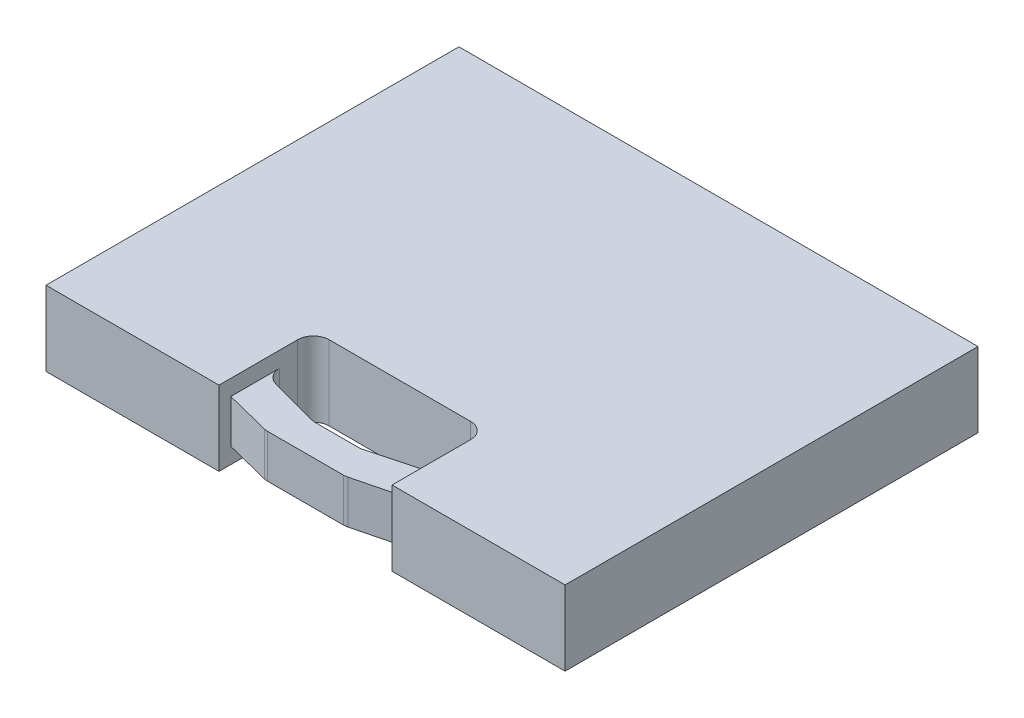
from build123d import *

# Parameters (mm, degrees)
SKETCH1_W           = 419.1
SKETCH1_H           = 333.375
BOSS_EXTRUDE1_DEPTH = 60.325
SKETCH2_W           = 139.7
SKETCH2_H           = 50.8
CUT_EXTRUDE1_DEPTH  = 275.47227689
CHAMFER1_SIZE       = 50.8
CHAMFER1_SIZE2      = 13.611818976
FILLET1_R           = 12.7
SKETCH3_W           = 139.7
SKETCH3_H           = 56.403006085
CUT_EXTRUDE2_DEPTH  = 12.7
SKETCH4_W           = 139.7
SKETCH4_H           = 56.128435861
CUT_EXTRUDE3_DEPTH  = 12.7


with BuildPart() as part:
    # Sketch1 → Boss-Extrude1 (new body)
    with BuildSketch(Plane(origin=(0, 0, 0), x_dir=(1, 0, 0), z_dir=(0, 1, 0))):
        Rectangle(SKETCH1_W, SKETCH1_H)
    extrude(amount=BOSS_EXTRUDE1_DEPTH)

    # Sketch2 → Cut-Extrude1 (cut, through all)
    with BuildSketch(Plane(origin=(0, 60.325, 0), x_dir=(1, 0, 0), z_dir=(0, 1, 0))):
        with Locations((0, -115.8875)):
            Rectangle(SKETCH2_W, SKETCH2_H)
        Polygon((-69.85, -166.6875), (-69.85, -157.1625), (-32.169017961, -166.6875), align=None)
        Polygon((32.169017961, -166.6875), (69.85, -166.6875), (69.85, -157.1625), align=None)
    extrude(amount=-CUT_EXTRUDE1_DEPTH, mode=Mode.SUBTRACT)

    # Chamfer1
    chamfer1_edges = [part.edges().sort_by_distance(p)[0] for p in [
        (69.85, 30.1625, 141.2875),
        (-69.85, 30.1625, 141.2875),
    ]]
    chamfer1_side = [part.faces().sort_by_distance(p)[0] for p in [
        (0, 30.1625, 141.2875),
    ]]
    chamfer(chamfer1_edges, length=CHAMFER1_SIZE, length2=CHAMFER1_SIZE2, reference=chamfer1_side[0])

    # Fillet1
    fillet1_edges = [part.edges().sort_by_distance(p)[0] for p in [
        (32.169017961, 30.1625, 166.6875),
        (-32.169017961, 30.1625, 166.6875),
        (69.85, 30.1625, 127.675681024),
        (19.05, 30.1625, 141.2875),
        (-19.05, 30.1625, 141.2875),
        (-69.85, 30.1625, 127.675681024),
        (69.85, 30.1625, 90.4875),
        (-69.85, 30.1625, 90.4875),
    ]]
    fillet(fillet1_edges, radius=FILLET1_R)

    # Sketch3 → Cut-Extrude2 (cut)
    with BuildSketch(Plane(origin=(0, 60.325, 0), x_dir=(1, 0, 0), z_dir=(0, 1, 0))):
        with Locations((0, -138.485996957)):
            Rectangle(SKETCH3_W, SKETCH3_H)
    extrude(amount=-CUT_EXTRUDE2_DEPTH, mode=Mode.SUBTRACT)

    # Sketch4 → Cut-Extrude3 (cut)
    with BuildSketch(Plane.XZ):
        with Locations((0, 138.623282069)):
            Rectangle(SKETCH4_W, SKETCH4_H)
    extrude(amount=-CUT_EXTRUDE3_DEPTH, mode=Mode.SUBTRACT)


solid = part.part
